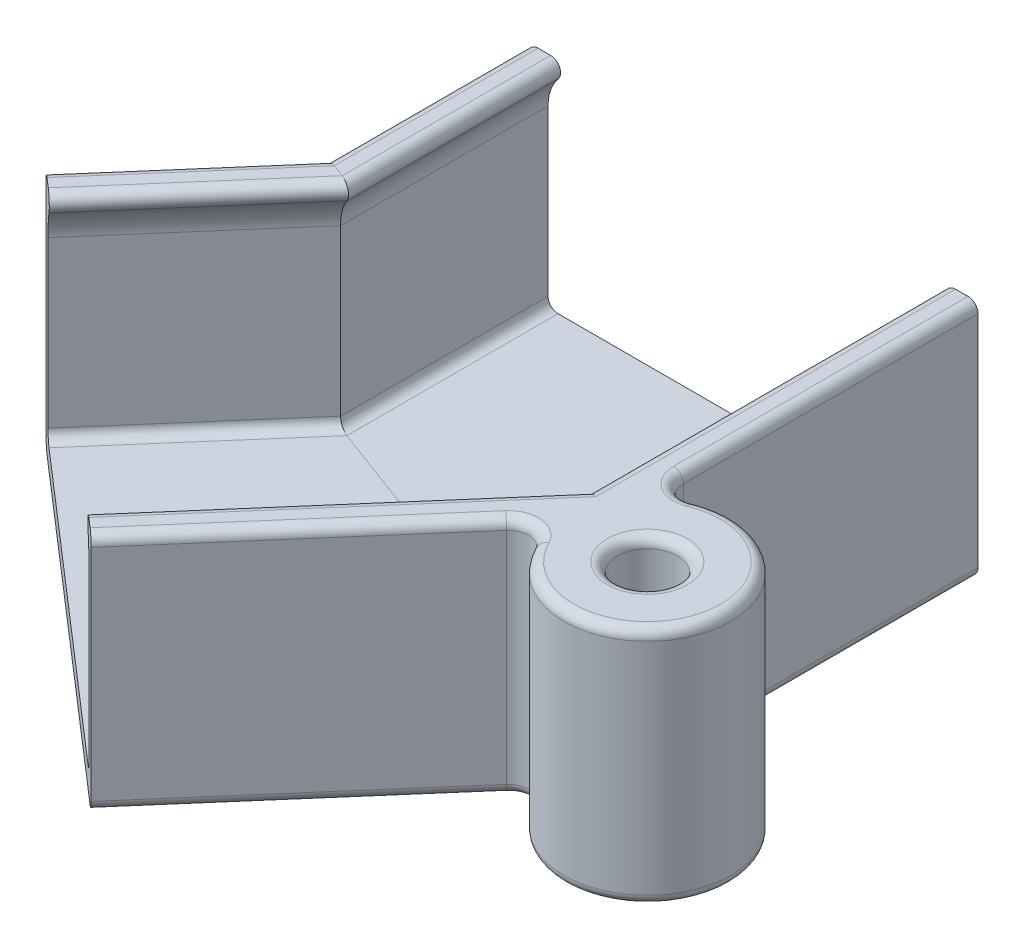
from build123d import *
from OCP.BRepFilletAPI import BRepFilletAPI_MakeChamfer

# Parameters (mm, degrees)
SKETCH4_R           = 2.9999999999999982
BOSS_EXTRUDE2_DEPTH = 24
CUT_EXTRUDE2_DEPTH  = 6
CUT_EXTRUDE2_DRAFT  = -2.0000000000000044
CHAMFER1_SIZE       = 1
CHAMFER1_SIZE2      = 1.0368159552784713
FILLET8_R           = 1


with BuildPart() as part:
    # Sweep1: sweep along a path in Sketch3
    with BuildLine(Plane(origin=(0, 0, 0), x_dir=(1, 0, 0), z_dir=(0, 1, 0))) as sweep1_path:
        Line((0, 0), (3.43e-15, -28.397932341701697))
        Line((3.43e-15, -28.397932341701697), (-18.606512367640427, -49.85114326213761))
    # Sketch1 → Sweep1 (sweep)
    with BuildSketch(Plane.XY):
        with BuildLine():
            Line((-19.500000000000004, -12.023018516113881), (19.500000000000004, -12.023018516113881))
            ThreePointArc((19.500000000000004, -12.023018516113881), (20.207106781186553, -11.730125297300427), (20.499999999999996, -11.02301851611388))
            Line((20.499999999999996, -11.02301851611388), (20.5, 5.476981483886118))
            ThreePointArc((20.5, 5.476981483886118), (20.235010721400677, 6.998390104086923), (19.471251471279412, 8.34061784752248))
            ThreePointArc((19.471251471279412, 8.34061784752248), (19.338106653385996, 9.403382916597337), (20.242640687119284, 9.976981483886115))
            Line((20.242640687119284, 9.976981483886115), (21.5, 9.976981483886117))
            ThreePointArc((21.5, 9.976981483886117), (22.207106781186546, 9.684088265072665), (22.5, 8.976981483886117))
            Line((22.5, 8.976981483886117), (22.500000000000004, -13.023018516113874))
            ThreePointArc((22.500000000000004, -13.023018516113874), (22.20710678118655, -13.730125297300424), (21.5, -14.023018516113883))
            Line((21.5, -14.023018516113883), (-21.5, -14.023018516113883))
            ThreePointArc((-21.5, -14.023018516113883), (-22.20710678118655, -13.730125297300424), (-22.500000000000004, -13.023018516113874))
            Line((-22.500000000000004, -13.023018516113874), (-22.5, 8.976981483886117))
            ThreePointArc((-22.5, 8.976981483886117), (-22.207106781186546, 9.684088265072665), (-21.5, 9.976981483886117))
            Line((-21.5, 9.976981483886117), (-20.242640687119284, 9.976981483886115))
            ThreePointArc((-20.242640687119284, 9.976981483886115), (-19.338106653385996, 9.403382916597337), (-19.471251471279412, 8.34061784752248))
            ThreePointArc((-19.471251471279412, 8.34061784752248), (-20.235010721400677, 6.998390104086923), (-20.5, 5.476981483886118))
            Line((-20.5, 5.476981483886118), (-20.499999999999996, -11.02301851611388))
            ThreePointArc((-20.499999999999996, -11.02301851611388), (-20.207106781186553, -11.730125297300429), (-19.500000000000004, -12.023018516113881))
        make_face()
    sweep(path=sweep1_path.line, transition=Transition.RIGHT)

    # Sketch4 → Boss-Extrude2 (add, through all)
    with BuildSketch(Plane(origin=(0, -14.023018516113883, 0), x_dir=(-1, 0, 0), z_dir=(0, -1, 0))):
        with BuildLine():
            Line((-21.5, -34.67531871716202), (-21.5, -29.459053367546638))
            Line((-21.5, -29.459053367546638), (-22.500000000000004, -29.459053367546638))
            ThreePointArc((-22.500000000000004, -29.459053367546638), (-23.388194611615152, -31.12154811290928), (-25.26388877835841, -31.307423983602327))
            ThreePointArc((-25.263888778358414, -31.307423983602334), (-36.264928425658965, -41.93350635482782), (-20.991916583156645, -42.753023981442176))
            ThreePointArc((-20.991916583156645, -42.75302398144217), (-19.45313679656983, -41.66447668579883), (-17.692872887894488, -42.33845696613024))
            Line((-17.692872887894488, -42.33845696613024), (-16.93742313675424, -41.68325037771543))
            Line((-16.93742313675424, -41.68325037771543), (-21.5, -36.42262324599441))
            Line((-21.5, -36.42262324599441), (-21.5, -34.67531871716202))
        make_face()
        with Locations(Location((-28.449921846657176, -39.01662206592069, 0), (0, 0, 90))):
            Circle(SKETCH4_R, mode=Mode.SUBTRACT)
    extrude(amount=-BOSS_EXTRUDE2_DEPTH)


with BuildPart() as cut_extrude2_tool:
    # Sketch5 → Cut-Extrude2 (with draft: the straight prism first)
    with BuildSketch(Plane(origin=(0, -14.023018516113883, 0), x_dir=(-1, 0, 0), z_dir=(0, -1, 0))):
        Polygon((-29.501650461083923, -45.27978422691646), (-23.551728614426768, -43.05902684439915), (-22.500000000000025, -36.79586468340338), (-27.39819323223043, -32.75345990492492), (-33.348115078887595, -34.974217287442244), (-34.39984369331434, -41.237379448438006), align=None)
    extrude(amount=-CUT_EXTRUDE2_DEPTH)
    # Cut-Extrude2: the draft: its side faces are tilted about the plane it starts from
    cut_extrude2_sides = [cut_extrude2_tool.faces().sort_by_distance(p)[0] for p in [
        (26.526689538, -11.023018516, 44.169405536),
        (23.025864307, -11.023018516, 39.927445764),
        (24.949096616, -11.023018516, 34.774662294),
        (30.373154156, -11.023018516, 33.863838596),
        (33.873979386, -11.023018516, 38.105798368),
        (31.950747077, -11.023018516, 43.258581838),
    ]]
    draft(cut_extrude2_sides, Plane(origin=(0, -14.023018516113883, 0), x_dir=(-1, 0, 0), z_dir=(0, -1, 0)), CUT_EXTRUDE2_DRAFT)


with BuildPart() as part_1:
    add(part.part)

    # Cut-Extrude2: cut by cut_extrude2_tool
    add(cut_extrude2_tool.part, mode=Mode.SUBTRACT)

    # Chamfer1: one chamfer whose edges measure the first distance from different faces: ONE call of the kernel's chamfer builder (chamfer() names one face for all edges)
    chamfer1_edges_1 = [part_1.edges().sort_by_distance(p)[0] for p in [
        (33.667347826415636, -8.023018516113883, 38.14049654729082),
    ]]
    chamfer1_side_1 = [part_1.faces().sort_by_distance(p)[0] for p in [
        (33.77133231943445, -11.042436068122724, 38.123035165331785),
    ]]
    chamfer1_edges_2 = [part_1.edges().sort_by_distance(p)[0] for p in [
        (30.299887880499114, -8.023018516113883, 34.060135865770036),
    ]]
    chamfer1_side_2 = [part_1.faces().sort_by_distance(p)[0] for p in [
        (30.336758126646806, -11.042436068122724, 33.96135196223658),
    ]]
    chamfer1_edges_3 = [part_1.edges().sort_by_distance(p)[0] for p in [
        (25.08246190074066, -8.023018516113883, 34.936261384399906),
    ]]
    chamfer1_side_3 = [part_1.faces().sort_by_distance(p)[0] for p in [
        (25.015347653869544, -11.042436068122724, 34.854938862825485),
    ]]
    chamfer1_edges_4 = [part_1.edges().sort_by_distance(p)[0] for p in [
        (23.232495866898734, -8.023018516113883, 39.89274758455057),
    ]]
    chamfer1_side_4 = [part_1.faces().sort_by_distance(p)[0] for p in [
        (23.12851137387992, -11.042436068122724, 39.91020896650961),
    ]]
    chamfer1_edges_5 = [part_1.edges().sort_by_distance(p)[0] for p in [
        (26.599955812815256, -8.023018516113883, 43.97310826607136),
    ]]
    chamfer1_side_5 = [part_1.faces().sort_by_distance(p)[0] for p in [
        (26.56308556666756, -11.042436068122724, 44.07189216960481),
    ]]
    chamfer1_edges_6 = [part_1.edges().sort_by_distance(p)[0] for p in [
        (31.81738179257371, -8.023018516113883, 43.09698274744148),
    ]]
    chamfer1_side_6 = [part_1.faces().sort_by_distance(p)[0] for p in [
        (31.88449603944482, -11.042436068122724, 43.178305269015894),
    ]]
    chamfer1 = BRepFilletAPI_MakeChamfer(part_1.part.solid().wrapped)
    for e in chamfer1_edges_1:
        chamfer1.Add(CHAMFER1_SIZE, CHAMFER1_SIZE2, e.wrapped, chamfer1_side_1[0].wrapped)  # the first distance lies on this face
    for e in chamfer1_edges_2:
        chamfer1.Add(CHAMFER1_SIZE, CHAMFER1_SIZE2, e.wrapped, chamfer1_side_2[0].wrapped)  # the first distance lies on this face
    for e in chamfer1_edges_3:
        chamfer1.Add(CHAMFER1_SIZE, CHAMFER1_SIZE2, e.wrapped, chamfer1_side_3[0].wrapped)  # the first distance lies on this face
    for e in chamfer1_edges_4:
        chamfer1.Add(CHAMFER1_SIZE, CHAMFER1_SIZE2, e.wrapped, chamfer1_side_4[0].wrapped)  # the first distance lies on this face
    for e in chamfer1_edges_5:
        chamfer1.Add(CHAMFER1_SIZE, CHAMFER1_SIZE2, e.wrapped, chamfer1_side_5[0].wrapped)  # the first distance lies on this face
    for e in chamfer1_edges_6:
        chamfer1.Add(CHAMFER1_SIZE, CHAMFER1_SIZE2, e.wrapped, chamfer1_side_6[0].wrapped)  # the first distance lies on this face
    add(Compound.cast(chamfer1.Shape()), mode=Mode.REPLACE)

    # Fillet8
    # the kernel refuses this fillet: 1 mm, written as the material it takes off along each edge
    with BuildSketch(Plane(origin=(24.500000000000004, -14.023018516113883, 29.459053367546634), x_dir=(-0.31457819430358575, 0, -0.9492315627225506), z_dir=(0.9492315627225506, 0, -0.31457819430358575))) as fillet8_piece_1:
        with BuildLine():
            CenterArc((2 + FILLET8_R, FILLET8_R), FILLET8_R, 180, 90)
            Line((2, FILLET8_R), (2, 0))
            Line((2, 0), (2 + FILLET8_R, 0))
        make_face()
    revolve(axis=Axis((24.500000000000004, -14.023018516113883, 29.459053367546634), (0, 1, 0)), revolution_arc=184.1188230563678, mode=Mode.SUBTRACT)
    with BuildSketch(Plane(origin=(24.500000000000004, 9.976981483886117, 29.459053367546634), x_dir=(-0.31457819430358197, 0, -0.9492315627225518), z_dir=(0.9492315627225518, 0, -0.31457819430358197))) as fillet8_piece_2:
        with BuildLine():
            CenterArc((2.000000000000001 + FILLET8_R, -FILLET8_R), FILLET8_R, 90, 90)
            Line((2.000000000000001 + FILLET8_R, 3.55e-15), (2.000000000000001, 3.55e-15))
            Line((2.000000000000001, 3.55e-15), (2.000000000000001, -FILLET8_R))
        make_face()
    revolve(axis=Axis((24.500000000000004, 9.976981483886117, 29.459053367546634), (0, 1, 0)), revolution_arc=184.11882305636792, mode=Mode.SUBTRACT)
    with BuildSketch(Plane(origin=(19.20377239017497, -14.023018516113883, 43.64887014295982), x_dir=(0.8940720964908377, 0, -0.4479230807588265), z_dir=(0.4479230807588265, 0, 0.8940720964908377))) as fillet8_piece_3:
        with BuildLine():
            CenterArc((2.0000000000000004 + FILLET8_R, FILLET8_R), FILLET8_R, 180, 90)
            Line((2.000000000000001, FILLET8_R), (2.0000000000000004, 0))
            Line((2.0000000000000004, 0), (2.0000000000000004 + FILLET8_R, 0))
        make_face()
    revolve(axis=Axis((19.20377239017497, -14.023018516113883, 43.64887014295982), (0, 1, 0)), revolution_arc=184.1188230563678, mode=Mode.SUBTRACT)
    with BuildSketch(Plane(origin=(19.20377239017497, 9.976981483886117, 43.64887014295982), x_dir=(0.8940720964908377, 0, -0.4479230807588265), z_dir=(0.4479230807588265, 0, 0.8940720964908377))) as fillet8_piece_4:
        with BuildLine():
            CenterArc((2.0000000000000004 + FILLET8_R, -FILLET8_R), FILLET8_R, 90.00000000000018, 89.99999999999983)
            Line((2.0000000000000004 + FILLET8_R, 0), (2.0000000000000004, 0))
            Line((2.0000000000000004, 0), (2.000000000000001, -FILLET8_R))
        make_face()
    revolve(axis=Axis((19.20377239017497, 9.976981483886117, 43.64887014295982), (0, 1, 0)), revolution_arc=184.1188230563678, mode=Mode.SUBTRACT)
    with BuildSketch(Plane(origin=(28.449921846657183, -14.023018516113883, 39.0166220659207), x_dir=(-0.3819443891792063, 0, -0.9241853080278452), z_dir=(-0.9241853080278452, 0, 0.3819443891792063))) as fillet8_piece_5:
        with BuildLine():
            CenterArc((8.341615058531193 - FILLET8_R, -FILLET8_R), FILLET8_R, 0, 90)
            Line((8.34161505853119, -FILLET8_R), (8.341615058531193, 0))
            Line((8.341615058531193, 0), (8.341615058531193 - FILLET8_R, 0))
        make_face()
    revolve(axis=Axis((28.449921846657183, -14.023018516113883, 39.0166220659207), (0, -1, 0)), revolution_arc=265.84366585936306, mode=Mode.SUBTRACT)
    with BuildSketch(Plane(origin=(28.449921846657183, 9.976981483886117, 39.0166220659207), x_dir=(-0.3819443891792063, 0, -0.9241853080278452), z_dir=(-0.9241853080278452, 0, 0.3819443891792063))) as fillet8_piece_6:
        with BuildLine():
            CenterArc((8.341615058531193 - FILLET8_R, FILLET8_R), FILLET8_R, 270.00000000000034, 89.99999999999966)
            Line((8.341615058531193 - FILLET8_R, 0), (8.341615058531193, 0))
            Line((8.341615058531193, 0), (8.34161505853119, FILLET8_R))
        make_face()
    revolve(axis=Axis((28.449921846657183, 9.976981483886117, 39.0166220659207), (0, -1, 0)), revolution_arc=265.84366585936306, mode=Mode.SUBTRACT)
    with BuildSketch(Plane(origin=(28.449921846657176, 9.976981483886117, 39.01662206592069), x_dir=(0, 0, -1), z_dir=(-1, 0, 0))) as fillet8_piece_7:
        with BuildLine():
            CenterArc((3 + FILLET8_R, FILLET8_R), FILLET8_R, 180, 90)
            Line((3 + FILLET8_R, 0), (3, 0))
            Line((3, 0), (3, FILLET8_R))
        make_face()
    revolve(axis=Axis((28.449921846657176, 9.976981483886117, 39.01662206592069), (0, -1, 0)), mode=Mode.SUBTRACT)


solid = part_1.part
